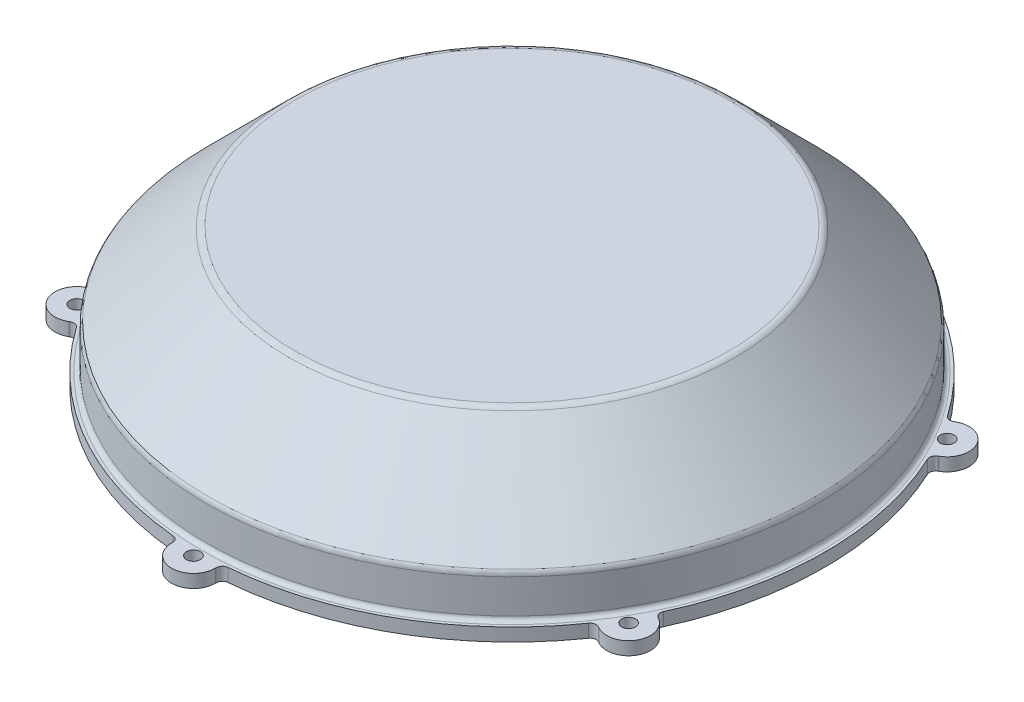
from build123d import *
from build123d.topology import SkipClean

# Parameters (mm, degrees)
SKETCH_1_R      = 70
SKETCH_1_R_2    = 67.5
EXTRUDE_1_DEPTH = 10
EXTRUDE_START   = 3
SKETCH_2_R      = 67.5
SKETCH_2_R_2    = 1.6
EXTRUDE_2_DEPTH = 3
FILLET_1_R      = 1
FILLET_2_R      = 2


with BuildPart() as part:
    # Эскиз1 → Бобышка-Вытянуть1 (new body)
    with BuildSketch(Plane(origin=(0, 0, 0), x_dir=(1, 0, 0), z_dir=(0, 1, 0))):
        with Locations(Location((0, 0, 0), (0, 0, 270))):
            Circle(SKETCH_1_R)
        with Locations(Location((0, 0, 0), (0, 0, 270))):
            Circle(SKETCH_1_R_2, mode=Mode.SUBTRACT)
    extrude(amount=EXTRUDE_1_DEPTH)

    # Эскиз2 → Бобышка-Вытянуть2 (add)
    with SkipClean():  # the faces are left unmerged after this step: merging them gives an invalid solid
        with BuildSketch(Plane.XZ.offset(EXTRUDE_START)):
            with BuildLine():
                Line((-5, 73), (-5, 72.783842909))
                ThreePointArc((-5, 72.783842909), (-5.367603881, 71.838243495), (-6.277368932, 71.389224101))
                ThreePointArc((-6.277368932, 71.389224101), (-35.832341113, 62.063435361), (-58.686197162, 41.130973015))
                ThreePointArc((-58.686197162, 41.130973015), (-59.52994189, 40.567603065), (-60.532656944, 40.722048474))
                Line((-60.532656944, 40.722048474), (-60.719854476, 40.830127019))
                ThreePointArc((-60.719854476, 40.830127019), (-67.549981495, 39), (-65.719854476, 32.169872981))
                Line((-65.719854476, 32.169872981), (-65.532656944, 32.061794436))
                ThreePointArc((-65.532656944, 32.061794436), (-64.89754577, 31.270640429), (-64.963566094, 30.258251086))
                ThreePointArc((-64.963566094, 30.258251086), (-71.664682225, 0), (-64.963566094, -30.258251086))
                ThreePointArc((-64.963566094, -30.258251086), (-64.89754577, -31.270640429), (-65.532656944, -32.061794436))
                Line((-65.532656944, -32.061794436), (-65.719854476, -32.169872981))
                ThreePointArc((-65.719854476, -32.169872981), (-67.549981495, -39), (-60.719854476, -40.830127019))
                Line((-60.719854476, -40.830127019), (-60.532656944, -40.722048474))
                ThreePointArc((-60.532656944, -40.722048474), (-59.52994189, -40.567603065), (-58.686197162, -41.130973015))
                ThreePointArc((-58.686197162, -41.130973015), (-35.832341113, -62.063435361), (-6.277368932, -71.389224101))
                ThreePointArc((-6.277368932, -71.389224101), (-5.367603881, -71.838243495), (-5, -72.783842909))
                Line((-5, -72.783842909), (-5, -73))
                ThreePointArc((-5, -73), (0, -78), (5, -73))
                Line((5, -73), (5, -72.783842909))
                ThreePointArc((5, -72.783842909), (5.367603881, -71.838243495), (6.277368932, -71.389224101))
                ThreePointArc((6.277368932, -71.389224101), (35.832341113, -62.063435361), (58.686197162, -41.130973015))
                ThreePointArc((58.686197162, -41.130973015), (59.52994189, -40.567603065), (60.532656944, -40.722048474))
                Line((60.532656944, -40.722048474), (60.719854476, -40.830127019))
                ThreePointArc((60.719854476, -40.830127019), (67.549981495, -39), (65.719854476, -32.169872981))
                Line((65.719854476, -32.169872981), (65.532656944, -32.061794436))
                ThreePointArc((65.532656944, -32.061794436), (64.89754577, -31.270640429), (64.963566094, -30.258251086))
                ThreePointArc((64.963566094, -30.258251086), (71.664682225, 0), (64.963566094, 30.258251086))
                ThreePointArc((64.963566094, 30.258251086), (64.89754577, 31.270640429), (65.532656944, 32.061794436))
                Line((65.532656944, 32.061794436), (65.719854476, 32.169872981))
                ThreePointArc((65.719854476, 32.169872981), (67.549981495, 39), (60.719854476, 40.830127019))
                Line((60.719854476, 40.830127019), (60.532656944, 40.722048474))
                ThreePointArc((60.532656944, 40.722048474), (59.52994189, 40.567603065), (58.686197162, 41.130973015))
                ThreePointArc((58.686197162, 41.130973015), (35.832341113, 62.063435361), (6.277368932, 71.389224101))
                ThreePointArc((6.277368932, 71.389224101), (5.367603881, 71.838243495), (5, 72.783842909))
                Line((5, 72.783842909), (5, 73))
                ThreePointArc((5, 73), (0, 78), (-5, 73))
            make_face()
            with Locations(Location((0, 0, 0), (0, 0, 270))):
                Circle(SKETCH_2_R, mode=Mode.SUBTRACT)
            with Locations(Location((0, 73, 0), (0, 0, 270))):
                Circle(SKETCH_2_R_2, mode=Mode.SUBTRACT)
            with Locations(Location((63.219854476, 36.5, 0), (0, 0, 270))):
                Circle(SKETCH_2_R_2, mode=Mode.SUBTRACT)
            with Locations(Location((63.219854476, -36.5, 0), (0, 0, 270))):
                Circle(SKETCH_2_R_2, mode=Mode.SUBTRACT)
            with Locations(Location((0, -73, 0), (0, 0, 270))):
                Circle(SKETCH_2_R_2, mode=Mode.SUBTRACT)
            with Locations(Location((-63.219854476, -36.5, 0), (0, 0, 270))):
                Circle(SKETCH_2_R_2, mode=Mode.SUBTRACT)
            with Locations(Location((-63.219854476, 36.5, 0), (0, 0, 270))):
                Circle(SKETCH_2_R_2, mode=Mode.SUBTRACT)
        extrude(amount=-EXTRUDE_2_DEPTH)

    # Скругление1
    fillet_1_edges = [part.edges().sort_by_distance(p)[0] for p in [
        (0, 0, -70),
    ]]
    fillet(fillet_1_edges, radius=FILLET_1_R)

    # Эскиз3 → Повернуть1 (revolve)
    with BuildSketch(Plane.XY, mode=Mode.PRIVATE) as revolve_1_sk:
        Polygon((-69.584637185, 10), (-50.584637185, 29), (0, 29), (0, 27), (-49.756210061, 27), (-66.756210061, 10), align=None)
    revolve(revolve_1_sk.sketch.rotate(Axis((0, 27, 0), (0, -1, 0)), 90), axis=Axis((0, 27, 0), (0, -1, 0)))

    # Скругление2
    # the kernel refuses this fillet: 2 mm, written as the material it takes off along each edge
    with BuildSketch(Plane(origin=(0, 29, 0), x_dir=(0, 0, -1), z_dir=(-1, 0, 0))) as fillet_2_piece_1:
        with BuildLine():
            CenterArc((50.584637185 - FILLET_2_R * 0.414213562373, FILLET_2_R), FILLET_2_R, 270, 45)
            Line((50.584637185 - FILLET_2_R * 0.414213562373, 0), (50.584637185 - FILLET_2_R * 0.414213562373, -FILLET_2_R * 0.02))
            Line((50.584637185 - FILLET_2_R * 0.414213562373, -FILLET_2_R * 0.02), (50.584637185 + FILLET_2_R * 0.00828427124746, -FILLET_2_R * 0.02))
            Line((50.584637185 + FILLET_2_R * 0.00828427124746, -FILLET_2_R * 0.02), (50.584637185 + FILLET_2_R * 0.307035354437, FILLET_2_R * 0.27875108319))
            Line((50.584637185 + FILLET_2_R * 0.307035354437, FILLET_2_R * 0.27875108319), (50.584637185 + FILLET_2_R * 0.292893218813, FILLET_2_R * 0.292893218813))
        make_face()
    revolve(axis=Axis((0, 29, 0), (0, -1, 0)), mode=Mode.SUBTRACT)
    with BuildSketch(Plane(origin=(0, 10, 0), x_dir=(0, 0, 1), z_dir=(-1, 0, 0))) as fillet_2_piece_2:
        with BuildLine():
            CenterArc((68, -1.220215141), FILLET_2_R, 0, 37.597281425)
            Line((69.584637185, 0), (69.616329929, 0.024404303))
            ThreePointArc((69.616329929, 0.024404303), (69.792318593, 0.04), (70, 0.04))
            Line((70, 0.04), (70.04, 0))
            Line((70.04, 0), (70.04, -1.220215141))
            Line((70.04, -1.220215141), (70, -1.220215141))
        make_face()
    revolve(axis=Axis((0, 10, 0), (0, 1, 0)), mode=Mode.SUBTRACT)


solid = part.part
